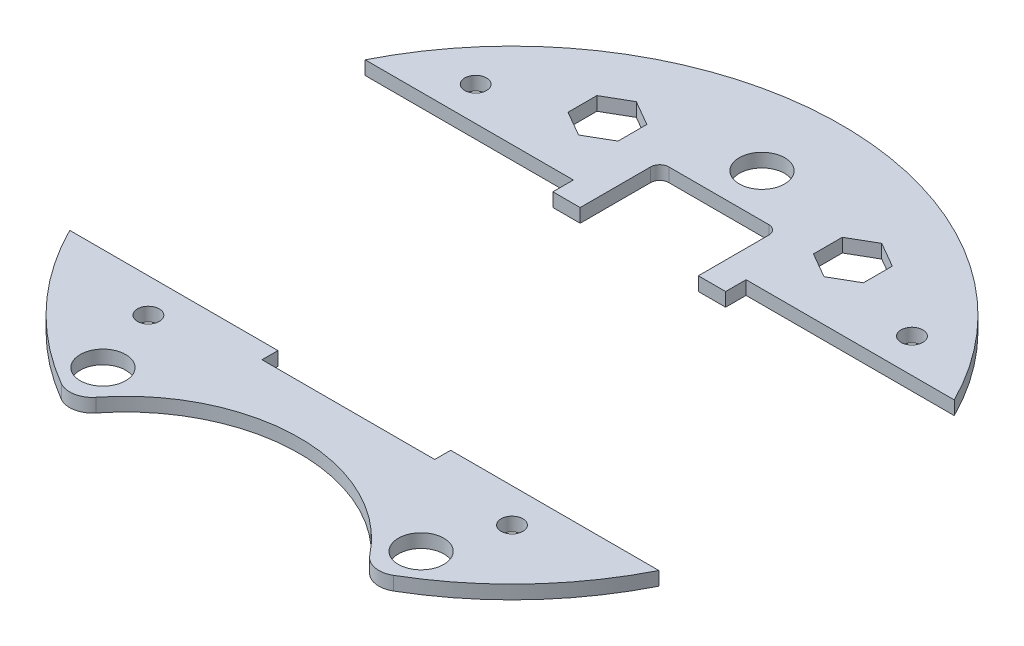
from build123d import *

# Parameters (mm, degrees)
BOSS_EXTRUDE1_DEPTH  = 3
SOLENOID_PLACEMENT_W = 38
SOLENOID_PLACEMENT_H = 64
CUT_EXTRUDE1_DEPTH   = 103.574363269
CUT_EXTRUDE5_DEPTH   = 103.574363269
SKETCH6_R            = 2.4
CUT_EXTRUDE6_DEPTH   = 103.574363269
CUT_EXTRUDE3_DEPTH   = 103.574363269
CUT_EXTRUDE7_DEPTH   = 98.289516393
SKETCH8_R            = 5
CUT_EXTRUDE9_DEPTH   = 98.289516393
SKETCH9_R            = 5
CUT_EXTRUDE11_DEPTH  = 98.289516393


with BuildPart() as part:
    # Sketch1 → Boss-Extrude1 (new body)
    with BuildSketch(Plane(origin=(0, 0, 0), x_dir=(1, 0, 0), z_dir=(0, 1, 0))):
        with BuildLine():
            ThreePointArc((36.543377003, -62.616544118), (0, 72.5), (-36.543377003, -62.616544118))
            ThreePointArc((-36.543377003, -62.616544118), (-33.085954668, -63.20954405), (-30.089832649, -61.38507948))
            ThreePointArc((-30.089832649, -61.38507948), (0, -46.75), (30.089832649, -61.38507948))
            ThreePointArc((30.089832649, -61.38507948), (33.085954668, -63.20954405), (36.543377003, -62.616544118))
        make_face()
    extrude(amount=BOSS_EXTRUDE1_DEPTH)

    # solenoid placement → Cut-Extrude1 (cut, through all)
    with BuildSketch(Plane(origin=(0, 3, 0), x_dir=(1, 0, 0), z_dir=(0, 1, 0))):
        with Locations((0, -4)):
            Rectangle(SOLENOID_PLACEMENT_W, SOLENOID_PLACEMENT_H)
    extrude(amount=-CUT_EXTRUDE1_DEPTH, mode=Mode.SUBTRACT)

    # Sketch5 → Cut-Extrude5 (cut, through all)
    with BuildSketch(Plane(origin=(0, 3, 0), x_dir=(1, 0, 0), z_dir=(0, 1, 0))):
        Polygon((-21.5, 51.175426481), (-27, 54.350852961), (-32.5, 51.175426481), (-32.5, 44.824573519), (-27, 41.649147039), (-21.5, 44.824573519), align=None)
        Polygon((21.5, 51.175426481), (21.5, 44.824573519), (27, 41.649147039), (32.5, 44.824573519), (32.5, 51.175426481), (27, 54.350852961), align=None)
    extrude(amount=-CUT_EXTRUDE5_DEPTH, mode=Mode.SUBTRACT)

    # Sketch6 → Cut-Extrude6 (cut, through all)
    with BuildSketch(Plane(origin=(0, 3, 0), x_dir=(1, 0, 0), z_dir=(0, 1, 0))):
        with Locations((40, -40)):
            Circle(SKETCH6_R)
        with Locations((-40, -40)):
            Circle(SKETCH6_R)
        with Locations((48, 40)):
            Circle(SKETCH6_R)
        with Locations((-48, 40)):
            Circle(SKETCH6_R)
    extrude(amount=-CUT_EXTRUDE6_DEPTH, mode=Mode.SUBTRACT)

    # Sketch3 → Cut-Extrude3 (cut, through all)
    with BuildSketch(Plane(origin=(0, 3, 0), x_dir=(1, 0, 0), z_dir=(0, 1, 0))):
        Polygon((-19, 28), (-19, 32.5), (-72.5, 32.5), (-72.5, -32.5), (72.5, -32.5), (72.5, 32.5), (19, 32.5), (19, 28), align=None)
    extrude(amount=-CUT_EXTRUDE3_DEPTH, mode=Mode.SUBTRACT)


with BuildPart() as cut_extrude3_piece_1:
    # of the separate pieces the step leaves, piece 1, a body of its own (cut_extrude3_pieces)
    add(part.part.solids().sort_by_distance((64.807406984, 0, -32.5))[0])

    # Sketch7 → Cut-Extrude7 (cut, through all)
    with BuildSketch(Plane(origin=(0, 3, 0), x_dir=(1, 0, 0), z_dir=(0, 1, 0))):
        with BuildLine():
            Line((13, 28), (13, 43.5))
            ThreePointArc((13, 43.5), (12.414213562, 44.914213562), (11, 45.5))
            Line((11, 45.5), (-11, 45.5))
            ThreePointArc((-11, 45.5), (-12.414213562, 44.914213562), (-13, 43.5))
            Line((-13, 43.5), (-13, 28))
            Line((-13, 28), (13, 28))
        make_face()
    extrude(amount=-CUT_EXTRUDE7_DEPTH, mode=Mode.SUBTRACT)

    # Sketch9 → Cut-Extrude11 (cut, through all)
    with BuildSketch(Plane.XZ.offset(-3)):
        with Locations((0, -55)):
            Circle(SKETCH9_R)
    extrude(amount=CUT_EXTRUDE11_DEPTH, mode=Mode.SUBTRACT)


with BuildPart() as cut_extrude3_piece_2:
    # of the separate pieces the step leaves, piece 2, a body of its own (cut_extrude3_pieces)
    add(part.part.solids().sort_by_distance((-36.543377003, 0, 62.616544118))[0])

    # Sketch8 → Cut-Extrude9 (cut, through all)
    with BuildSketch(Plane.XZ.offset(-3)):
        with Locations((35, 55)):
            Circle(SKETCH8_R)
        with Locations((-35, 55)):
            Circle(SKETCH8_R)
    extrude(amount=CUT_EXTRUDE9_DEPTH, mode=Mode.SUBTRACT)


solid = Compound([cut_extrude3_piece_1.part, cut_extrude3_piece_2.part])
